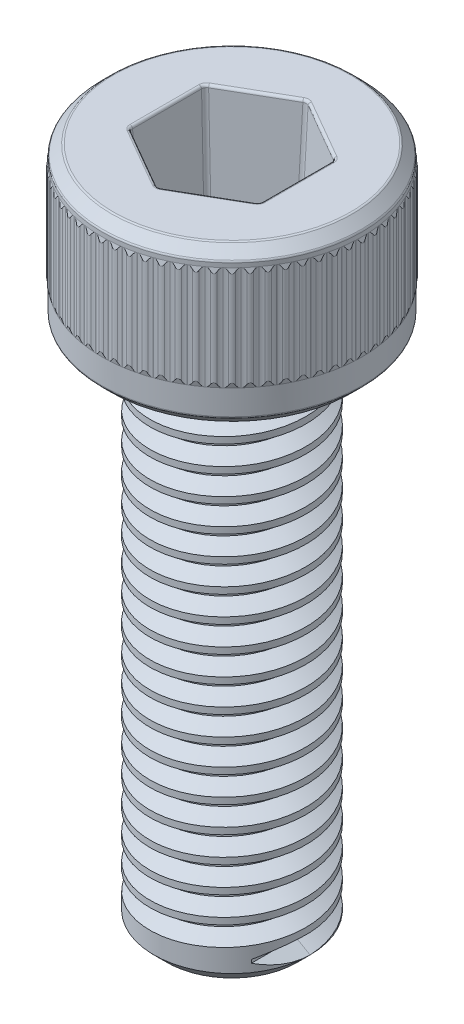
from build123d import *

# Parameters (mm, degrees)
SKETCH_1_R          = 5
EXTRUDE_1_DEPTH     = 6
CUT_EXTRUDE_1_DEPTH = 4
CUT_EXTRUDE_1_DRAFT = -3
FILLET_1_R          = 0.2
FILLET_2_R          = 0.1
CHAMFER_1_SIZE      = 0.4
FILLET_3_R          = 0.1
SKETCH_3_R          = 3
EXTRUDE_2_DEPTH     = 20
CHAMFER_2_SIZE      = 0.5
THREAD_1_PITCH      = 1
EXTRUDE_START       = -0.6
EXTRUDE_3_DEPTH     = 4
CUT_EXTRUDE_2_DEPTH = 22.232335203


with BuildPart() as part:
    # Sketch 1 → Бобышка-Вытянуть1 (new body)
    with BuildSketch(Plane(origin=(0, 0, 0), x_dir=(1, 0, 0), z_dir=(0, 1, 0))):
        with Locations(Location((0, 0, 0), (0, 0, 270))):
            Circle(SKETCH_1_R)
    extrude(amount=EXTRUDE_1_DEPTH)


with BuildPart() as cut_extrude_1_tool:
    # Эскиз2 → Вырез-Вытянуть1 (with draft: the straight prism first)
    with BuildSketch(Plane(origin=(0, 6, 0), x_dir=(1, 0, 0), z_dir=(0, 1, 0))):
        Polygon((0, 2.886751346), (-2.5, 1.443375673), (-2.5, -1.443375673), (0, -2.886751346), (2.5, -1.443375673), (2.5, 1.443375673), align=None)
    extrude(amount=-CUT_EXTRUDE_1_DEPTH)
    # Вырез-Вытянуть1: the draft: its side faces are tilted about the plane it starts from
    cut_extrude_1_sides = [cut_extrude_1_tool.faces().sort_by_distance(p)[0] for p in [
        (-1.25, 4, -2.165063509),
        (-2.5, 4, 0),
        (-1.25, 4, 2.165063509),
        (1.25, 4, 2.165063509),
        (2.5, 4, 0),
        (1.25, 4, -2.165063509),
    ]]
    draft(cut_extrude_1_sides, Plane(origin=(0, 6, 0), x_dir=(1, 0, 0), z_dir=(0, 1, 0)), CUT_EXTRUDE_1_DRAFT)


with BuildPart() as part_1:
    add(part.part)

    # Вырез-Вытянуть1: cut by cut_extrude_1_tool
    add(cut_extrude_1_tool.part, mode=Mode.SUBTRACT)

    # Скругление1
    fillet_1_edges = [part_1.edges().sort_by_distance(p)[0] for p in [
        (-2.395184441, 4, 1.382860382),
        (-2.395184441, 4, -1.382860382),
        (0, 4, -2.765720764),
        (2.395184441, 4, -1.382860382),
        (2.395184441, 4, 1.382860382),
        (0, 4, 2.765720764),
    ]]
    fillet(fillet_1_edges, radius=FILLET_1_R)

    # Скругление2
    fillet_2_edges = [part_1.edges().sort_by_distance(p)[0] for p in [
        (-1.25, 6, 2.165063509),
        (-2.5, 6, 0),
        (1.25, 6, 2.165063509),
        (2.5, 6, 0),
        (1.25, 6, -2.165063509),
        (-1.25, 6, -2.165063509),
        (-2.473247469, 6, 1.427930092),
        (0, 6, 2.855860184),
        (2.473247469, 6, 1.427930092),
        (2.473247469, 6, -1.427930092),
        (0, 6, -2.855860184),
        (-2.473247469, 6, -1.427930092),
    ]]
    fillet(fillet_2_edges, radius=FILLET_2_R)

    # Фаска1
    chamfer_1_edges = [part_1.edges().sort_by_distance(p)[0] for p in [
        (0, 0, -5),
        (0, 6, -5),
    ]]
    chamfer(chamfer_1_edges, length=CHAMFER_1_SIZE)

    # Скругление3
    fillet_3_edges = [part_1.edges().sort_by_distance(p)[0] for p in [
        (0, 6, -4.6),
        (0, 5.6, -5),
        (0, 0.4, -5),
        (0, 0, -4.6),
    ]]
    fillet(fillet_3_edges, radius=FILLET_3_R)

    # Эскиз3 → Бобышка-Вытянуть2 (add)
    with BuildSketch(Plane.XZ):
        with Locations(Location((0, 0, 0), (0, 0, 90))):
            Circle(SKETCH_3_R)
    extrude(amount=EXTRUDE_2_DEPTH)

    # Фаска2
    chamfer_2_edges = [part_1.edges().sort_by_distance(p)[0] for p in [
        (0, -20, -3),
    ]]
    chamfer(chamfer_2_edges, length=CHAMFER_2_SIZE)

    # Резьба1: the profile of Sketch 1 2 profile screwed along a right-hand helix of 19.5 turns, 8 arcs to a turn; built about Z, then put on its axis
    thread_1_z = Axis((0, 0, 0), (0, 0, 1))
    thread_1_corners = [(3.0003, 0, -0.000173205), (2.458734125, 0, 0.312499999), (2.458734125, 0, 0.437499999), (3.0003, 0, 0.750173202)]
    with BuildLine(mode=Mode.PRIVATE) as thread_1_profile:
        Line(thread_1_corners[0], thread_1_corners[1])
        Line(thread_1_corners[1], thread_1_corners[2])
        Line(thread_1_corners[2], thread_1_corners[3])
        Line(thread_1_corners[3], thread_1_corners[0])
    thread_1_cap = Face(thread_1_profile.wire())
    thread_1_turn_angles = [0, 22.5, 45, 67.5, 90, 112.5, 135, 157.5, 180, 202.5, 225, 247.5, 270, 292.5, 315, 337.5, 360]
    thread_1_turn_weights = [1, 0.9238795325112867, 1, 0.9238795325112867, 1, 0.9238795325112867, 1, 0.9238795325112867, 1, 0.9238795325112867, 1, 0.9238795325112867, 1, 0.9238795325112867, 1, 0.9238795325112867, 1]
    thread_1_turn_rails = [Edge.make_bspline([Vector(p[0], p[1], 0).rotate(thread_1_z, thread_1_turn_angles[k]) / thread_1_turn_weights[k] + Vector(0, 0, p[2] + THREAD_1_PITCH * thread_1_turn_angles[k] / 360) for k in range(17)], [0, 0, 0, 1, 1, 2, 2, 3, 3, 4, 4, 5, 5, 6, 6, 7, 7, 8, 8, 8], 2, thread_1_turn_weights) for p in thread_1_corners]
    thread_1_turn_sides = [Face.make_surface_from_curves(thread_1_turn_rails[p[0]], thread_1_turn_rails[p[1]]) for p in [(0, 1), (1, 2), (2, 3), (3, 0)]]
    thread_1_last_angles = [6840, 6862.5, 6885, 6907.5, 6930, 6952.5, 6975, 6997.5, 7020]
    thread_1_last_weights = [1, 0.9238795325112867, 1, 0.9238795325112867, 1, 0.9238795325112867, 1, 0.9238795325112958, 1]
    thread_1_last_rails = [Edge.make_bspline([Vector(p[0], p[1], 0).rotate(thread_1_z, thread_1_last_angles[k]) / thread_1_last_weights[k] + Vector(0, 0, p[2] + THREAD_1_PITCH * thread_1_last_angles[k] / 360) for k in range(9)], [0, 0, 0, 1, 1, 2, 2, 3, 3, 4, 4, 4], 2, thread_1_last_weights) for p in thread_1_corners]
    thread_1_last_sides = [Face.make_surface_from_curves(thread_1_last_rails[p[0]], thread_1_last_rails[p[1]]) for p in [(0, 1), (1, 2), (2, 3), (3, 0)]]
    thread_1 = Plane(origin=(0, -19.5, 0), x_dir=(1, 0, 0), z_dir=(0, 1, 0)) * Solid(Shell([*[p.moved(Location((0, 0, THREAD_1_PITCH * i))) for i in range(19) for p in thread_1_turn_sides], *thread_1_last_sides, thread_1_cap, thread_1_cap.rotate(thread_1_z, 7020).moved(Location((0, 0, THREAD_1_PITCH * 7020 / 360)))]))
    add(thread_1, mode=Mode.SUBTRACT)

    # Эскиз8 → Бобышка-Вытянуть3 (add)
    with BuildSketch(Plane(origin=(0, 6, 0), x_dir=(1, 0, 0), z_dir=(0, 1, 0)).offset(EXTRUDE_START)):
        with BuildLine():
            Line((-0.239429025, 4.994264084), (-0.033196375, 4.753218038))
            Line((-0.033196375, 4.753218038), (0.239429025, 4.994264084))
            ThreePointArc((0.239429025, 4.994264084), (0.164221826, 5.003619827), (0.091292563, 5.024234752))
            ThreePointArc((0.091292563, 5.024234752), (0, 5.040439273), (-0.091292563, 5.024234752))
            ThreePointArc((-0.091292563, 5.024234752), (-0.164221826, 5.003619827), (-0.239429025, 4.994264084))
        make_face()
        with BuildLine():
            Line((0.251247375, 4.993683486), (0.432860314, 4.733583808))
            Line((0.432860314, 4.733583808), (0.727799592, 4.946747189))
            ThreePointArc((0.727799592, 4.946747189), (0.65387156, 4.963429476), (0.583314087, 4.991093453))
            ThreePointArc((0.583314087, 4.991093453), (0.494049444, 5.016168181), (0.401608159, 5.008989924))
            ThreePointArc((0.401608159, 5.008989924), (0.327009454, 4.995622583), (0.251247375, 4.993683486))
        make_face()
        with BuildLine():
            Line((0.739504125, 4.945010986), (0.894748321, 4.668362578))
            Line((0.894748321, 4.668362578), (1.209161052, 4.851590415))
            ThreePointArc((1.209161052, 4.851590415), (1.137224153, 4.875438586), (1.069717977, 4.909885195))
            ThreePointArc((1.069717977, 4.909885195), (0.983340921, 4.943588646), (0.890641174, 4.945505786))
            ThreePointArc((0.890641174, 4.945505786), (0.815091453, 4.939514764), (0.739504125, 4.945010986))
        make_face()
        with BuildLine():
            Line((1.220639047, 4.848715327), (1.348019414, 4.558182464))
            Line((1.348019414, 4.558182464), (1.678877629, 4.709710172))
            ThreePointArc((1.678877629, 4.709710172), (1.609624656, 4.740494557), (1.545819899, 4.781392058))
            ThreePointArc((1.545819899, 4.781392058), (1.463162288, 4.82339965), (1.371096828, 4.834393722))
            ThreePointArc((1.371096828, 4.834393722), (1.295323677, 4.835836717), (1.220639047, 4.848715327))
        make_face()
        with BuildLine():
            Line((1.690018546, 4.705723888), (1.788308342, 4.404104562))
            Line((1.788308342, 4.404104562), (2.132425697, 4.522472846))
            ThreePointArc((2.132425697, 4.522472846), (2.066523594, 4.559896974), (2.00703473, 4.606851503))
            ThreePointArc((2.00703473, 4.606851503), (1.928892602, 4.65675868), (1.83834807, 4.676723805))
            ThreePointArc((1.83834807, 4.676723805), (1.763081226, 4.685586919), (1.690018546, 4.705723888))
        make_face()
        with BuildLine():
            Line((2.143122244, 4.517413757), (2.211374883, 4.207612725))
            Line((2.211374883, 4.207612725), (2.56543734, 4.291681635))
            ThreePointArc((2.56543734, 4.291681635), (2.503520779, 4.335385091), (2.448920719, 4.387944449))
            ThreePointArc((2.448920719, 4.387944449), (2.376046626, 4.445270577), (2.287895015, 4.474014481))
            ThreePointArc((2.287895015, 4.474014481), (2.213859338, 4.490212357), (2.143122244, 4.517413757))
        make_face()
        with BuildLine():
            Line((2.575586503, 4.285598461), (2.613144676, 3.970599277))
            Line((2.613144676, 3.970599277), (2.973742419, 4.019559183))
            ThreePointArc((2.973742419, 4.019559183), (2.916407691, 4.069121079), (2.867222264, 4.126779091))
            ThreePointArc((2.867222264, 4.126779091), (2.800318022, 4.190972088), (2.71540828, 4.228217952))
            ThreePointArc((2.71540828, 4.228217952), (2.643316775, 4.251594596), (2.575586503, 4.285598461))
        make_face()
        with BuildLine():
            Line((2.983246455, 4.012510509), (2.989748456, 3.695346788))
            Line((2.989748456, 3.695346788), (3.353408733, 3.708726179))
            ThreePointArc((3.353408733, 3.708726179), (3.301208003, 3.763669207), (3.25791089, 3.825870595))
            ThreePointArc((3.25791089, 3.825870595), (3.197620824, 3.896312248), (3.11677068, 3.941701372))
            ThreePointArc((3.11677068, 3.941701372), (3.047317626, 3.972031654), (2.983246455, 4.012510509))
        make_face()
        with BuildLine():
            Line((3.362176114, 3.700779888), (3.337559325, 3.384506089))
            Line((3.337559325, 3.384506089), (3.700779888, 3.362176114))
            ThreePointArc((3.700779888, 3.362176114), (3.654215877, 3.421971143), (3.617224053, 3.488116873))
            ThreePointArc((3.617224053, 3.488116873), (3.56412879, 3.56412879), (3.488116873, 3.617224053))
            ThreePointArc((3.488116873, 3.617224053), (3.421971143, 3.654215877), (3.362176114, 3.700779888))
        make_face()
        with BuildLine():
            Line((3.708726179, 3.353408733), (3.653227673, 3.041070747))
            Line((3.653227673, 3.041070747), (4.012510509, 2.983246455))
            ThreePointArc((4.012510509, 2.983246455), (3.972031654, 3.047317626), (3.941701372, 3.11677068))
            ThreePointArc((3.941701372, 3.11677068), (3.896312248, 3.197620824), (3.825870595, 3.25791089))
            ThreePointArc((3.825870595, 3.25791089), (3.763669207, 3.301208003), (3.708726179, 3.353408733))
        make_face()
        with BuildLine():
            Line((4.019559183, 2.973742419), (3.933713441, 2.66834823))
            Line((3.933713441, 2.66834823), (4.285598461, 2.575586503))
            ThreePointArc((4.285598461, 2.575586503), (4.251594596, 2.643316775), (4.228217952, 2.71540828))
            ThreePointArc((4.228217952, 2.71540828), (4.190972088, 2.800318022), (4.126779091, 2.867222264))
            ThreePointArc((4.126779091, 2.867222264), (4.069121079, 2.916407691), (4.019559183, 2.973742419))
        make_face()
        with BuildLine():
            Line((4.291681635, 2.56543734), (4.176315399, 2.269928062))
            Line((4.176315399, 2.269928062), (4.517413757, 2.143122244))
            ThreePointArc((4.517413757, 2.143122244), (4.490212357, 2.213859338), (4.474014481, 2.287895015))
            ThreePointArc((4.474014481, 2.287895015), (4.445270577, 2.376046626), (4.387944449, 2.448920719))
            ThreePointArc((4.387944449, 2.448920719), (4.335385091, 2.503520779), (4.291681635, 2.56543734))
        make_face()
        with BuildLine():
            Line((4.522472846, 2.132425697), (4.378697156, 1.849647245))
            Line((4.378697156, 1.849647245), (4.705723888, 1.690018546))
            ThreePointArc((4.705723888, 1.690018546), (4.685586919, 1.763081226), (4.676723805, 1.83834807))
            ThreePointArc((4.676723805, 1.83834807), (4.65675868, 1.928892602), (4.606851503, 2.00703473))
            ThreePointArc((4.606851503, 2.00703473), (4.559896974, 2.066523594), (4.522472846, 2.132425697))
        make_face()
        with BuildLine():
            Line((4.709710172, 1.678877629), (4.538909666, 1.411553315))
            Line((4.538909666, 1.411553315), (4.848715327, 1.220639047))
            ThreePointArc((4.848715327, 1.220639047), (4.835836717, 1.295323677), (4.834393722, 1.371096828))
            ThreePointArc((4.834393722, 1.371096828), (4.82339965, 1.463162288), (4.781392058, 1.545819899))
            ThreePointArc((4.781392058, 1.545819899), (4.740494557, 1.609624656), (4.709710172, 1.678877629))
        make_face()
        with BuildLine():
            Line((4.851590415, 1.209161052), (4.655409995, 0.959865354))
            Line((4.655409995, 0.959865354), (4.945010986, 0.739504125))
            ThreePointArc((4.945010986, 0.739504125), (4.939514764, 0.815091453), (4.945505786, 0.890641174))
            ThreePointArc((4.945505786, 0.890641174), (4.943588646, 0.983340921), (4.909885195, 1.069717977))
            ThreePointArc((4.909885195, 1.069717977), (4.875438586, 1.137224153), (4.851590415, 1.209161052))
        make_face()
        with BuildLine():
            Line((4.946747189, 0.727799592), (4.72707618, 0.498933365))
            Line((4.72707618, 0.498933365), (4.993683486, 0.251247375))
            ThreePointArc((4.993683486, 0.251247375), (4.995622583, 0.327009454), (5.008989924, 0.401608159))
            ThreePointArc((5.008989924, 0.401608159), (5.016168181, 0.494049444), (4.991093453, 0.583314087))
            ThreePointArc((4.991093453, 0.583314087), (4.963429476, 0.65387156), (4.946747189, 0.727799592))
        make_face()
        with BuildLine():
            Line((4.994264084, 0.239429025), (4.753218038, 0.033196375))
            Line((4.753218038, 0.033196375), (4.994264084, -0.239429025))
            ThreePointArc((4.994264084, -0.239429025), (5.003619827, -0.164221826), (5.024234752, -0.091292563))
            ThreePointArc((5.024234752, -0.091292563), (5.040439273, 0), (5.024234752, 0.091292563))
            ThreePointArc((5.024234752, 0.091292563), (5.003619827, 0.164221826), (4.994264084, 0.239429025))
        make_face()
        with BuildLine():
            Line((4.993683486, -0.251247375), (4.733583808, -0.432860314))
            Line((4.733583808, -0.432860314), (4.946747189, -0.727799592))
            ThreePointArc((4.946747189, -0.727799592), (4.963429476, -0.65387156), (4.991093453, -0.583314087))
            ThreePointArc((4.991093453, -0.583314087), (5.016168181, -0.494049444), (5.008989924, -0.401608159))
            ThreePointArc((5.008989924, -0.401608159), (4.995622583, -0.327009454), (4.993683486, -0.251247375))
        make_face()
        with BuildLine():
            Line((4.945010986, -0.739504125), (4.668362578, -0.894748321))
            Line((4.668362578, -0.894748321), (4.851590415, -1.209161052))
            ThreePointArc((4.851590415, -1.209161052), (4.875438586, -1.137224153), (4.909885195, -1.069717977))
            ThreePointArc((4.909885195, -1.069717977), (4.943588646, -0.983340921), (4.945505786, -0.890641174))
            ThreePointArc((4.945505786, -0.890641174), (4.939514764, -0.815091453), (4.945010986, -0.739504125))
        make_face()
        with BuildLine():
            Line((4.848715327, -1.220639047), (4.558182464, -1.348019414))
            Line((4.558182464, -1.348019414), (4.709710172, -1.678877629))
            ThreePointArc((4.709710172, -1.678877629), (4.740494557, -1.609624656), (4.781392058, -1.545819899))
            ThreePointArc((4.781392058, -1.545819899), (4.82339965, -1.463162288), (4.834393722, -1.371096828))
            ThreePointArc((4.834393722, -1.371096828), (4.835836717, -1.295323677), (4.848715327, -1.220639047))
        make_face()
        with BuildLine():
            Line((4.705723888, -1.690018546), (4.404104562, -1.788308342))
            Line((4.404104562, -1.788308342), (4.522472846, -2.132425697))
            ThreePointArc((4.522472846, -2.132425697), (4.559896974, -2.066523594), (4.606851503, -2.00703473))
            ThreePointArc((4.606851503, -2.00703473), (4.65675868, -1.928892602), (4.676723805, -1.83834807))
            ThreePointArc((4.676723805, -1.83834807), (4.685586919, -1.763081226), (4.705723888, -1.690018546))
        make_face()
        with BuildLine():
            Line((4.517413757, -2.143122244), (4.207612725, -2.211374883))
            Line((4.207612725, -2.211374883), (4.291681635, -2.56543734))
            ThreePointArc((4.291681635, -2.56543734), (4.335385091, -2.503520779), (4.387944449, -2.448920719))
            ThreePointArc((4.387944449, -2.448920719), (4.445270577, -2.376046626), (4.474014481, -2.287895015))
            ThreePointArc((4.474014481, -2.287895015), (4.490212357, -2.213859338), (4.517413757, -2.143122244))
        make_face()
        with BuildLine():
            Line((4.285598461, -2.575586503), (3.970599277, -2.613144676))
            Line((3.970599277, -2.613144676), (4.019559183, -2.973742419))
            ThreePointArc((4.019559183, -2.973742419), (4.069121079, -2.916407691), (4.126779091, -2.867222264))
            ThreePointArc((4.126779091, -2.867222264), (4.190972088, -2.800318022), (4.228217952, -2.71540828))
            ThreePointArc((4.228217952, -2.71540828), (4.251594596, -2.643316775), (4.285598461, -2.575586503))
        make_face()
        with BuildLine():
            Line((4.012510509, -2.983246455), (3.695346788, -2.989748456))
            Line((3.695346788, -2.989748456), (3.708726179, -3.353408733))
            ThreePointArc((3.708726179, -3.353408733), (3.763669207, -3.301208003), (3.825870595, -3.25791089))
            ThreePointArc((3.825870595, -3.25791089), (3.896312248, -3.197620824), (3.941701372, -3.11677068))
            ThreePointArc((3.941701372, -3.11677068), (3.972031654, -3.047317626), (4.012510509, -2.983246455))
        make_face()
        with BuildLine():
            Line((3.700779888, -3.362176114), (3.384506089, -3.337559325))
            Line((3.384506089, -3.337559325), (3.362176114, -3.700779888))
            ThreePointArc((3.362176114, -3.700779888), (3.421971143, -3.654215877), (3.488116873, -3.617224053))
            ThreePointArc((3.488116873, -3.617224053), (3.56412879, -3.56412879), (3.617224053, -3.488116873))
            ThreePointArc((3.617224053, -3.488116873), (3.654215877, -3.421971143), (3.700779888, -3.362176114))
        make_face()
        with BuildLine():
            Line((3.353408733, -3.708726179), (3.041070747, -3.653227673))
            Line((3.041070747, -3.653227673), (2.983246455, -4.012510509))
            ThreePointArc((2.983246455, -4.012510509), (3.047317626, -3.972031654), (3.11677068, -3.941701372))
            ThreePointArc((3.11677068, -3.941701372), (3.197620824, -3.896312248), (3.25791089, -3.825870595))
            ThreePointArc((3.25791089, -3.825870595), (3.301208003, -3.763669207), (3.353408733, -3.708726179))
        make_face()
        with BuildLine():
            Line((2.973742419, -4.019559183), (2.66834823, -3.933713441))
            Line((2.66834823, -3.933713441), (2.575586503, -4.285598461))
            ThreePointArc((2.575586503, -4.285598461), (2.643316775, -4.251594596), (2.71540828, -4.228217952))
            ThreePointArc((2.71540828, -4.228217952), (2.800318022, -4.190972088), (2.867222264, -4.126779091))
            ThreePointArc((2.867222264, -4.126779091), (2.916407691, -4.069121079), (2.973742419, -4.019559183))
        make_face()
        with BuildLine():
            Line((2.56543734, -4.291681635), (2.269928062, -4.176315399))
            Line((2.269928062, -4.176315399), (2.143122244, -4.517413757))
            ThreePointArc((2.143122244, -4.517413757), (2.213859338, -4.490212357), (2.287895015, -4.474014481))
            ThreePointArc((2.287895015, -4.474014481), (2.376046626, -4.445270577), (2.448920719, -4.387944449))
            ThreePointArc((2.448920719, -4.387944449), (2.503520779, -4.335385091), (2.56543734, -4.291681635))
        make_face()
        with BuildLine():
            Line((2.132425697, -4.522472846), (1.849647245, -4.378697156))
            Line((1.849647245, -4.378697156), (1.690018546, -4.705723888))
            ThreePointArc((1.690018546, -4.705723888), (1.763081226, -4.685586919), (1.83834807, -4.676723805))
            ThreePointArc((1.83834807, -4.676723805), (1.928892602, -4.65675868), (2.00703473, -4.606851503))
            ThreePointArc((2.00703473, -4.606851503), (2.066523594, -4.559896974), (2.132425697, -4.522472846))
        make_face()
        with BuildLine():
            Line((1.678877629, -4.709710172), (1.411553315, -4.538909666))
            Line((1.411553315, -4.538909666), (1.220639047, -4.848715327))
            ThreePointArc((1.220639047, -4.848715327), (1.295323677, -4.835836717), (1.371096828, -4.834393722))
            ThreePointArc((1.371096828, -4.834393722), (1.463162288, -4.82339965), (1.545819899, -4.781392058))
            ThreePointArc((1.545819899, -4.781392058), (1.609624656, -4.740494557), (1.678877629, -4.709710172))
        make_face()
        with BuildLine():
            Line((1.209161052, -4.851590415), (0.959865354, -4.655409995))
            Line((0.959865354, -4.655409995), (0.739504125, -4.945010986))
            ThreePointArc((0.739504125, -4.945010986), (0.815091453, -4.939514764), (0.890641174, -4.945505786))
            ThreePointArc((0.890641174, -4.945505786), (0.983340921, -4.943588646), (1.069717977, -4.909885195))
            ThreePointArc((1.069717977, -4.909885195), (1.137224153, -4.875438586), (1.209161052, -4.851590415))
        make_face()
        with BuildLine():
            Line((0.727799592, -4.946747189), (0.498933365, -4.72707618))
            Line((0.498933365, -4.72707618), (0.251247375, -4.993683486))
            ThreePointArc((0.251247375, -4.993683486), (0.327009454, -4.995622583), (0.401608159, -5.008989924))
            ThreePointArc((0.401608159, -5.008989924), (0.494049444, -5.016168181), (0.583314087, -4.991093453))
            ThreePointArc((0.583314087, -4.991093453), (0.65387156, -4.963429476), (0.727799592, -4.946747189))
        make_face()
        with BuildLine():
            Line((0.239429025, -4.994264084), (0.033196375, -4.753218038))
            Line((0.033196375, -4.753218038), (-0.239429025, -4.994264084))
            ThreePointArc((-0.239429025, -4.994264084), (-0.164221826, -5.003619827), (-0.091292563, -5.024234752))
            ThreePointArc((-0.091292563, -5.024234752), (0, -5.040439273), (0.091292563, -5.024234752))
            ThreePointArc((0.091292563, -5.024234752), (0.164221826, -5.003619827), (0.239429025, -4.994264084))
        make_face()
        with BuildLine():
            Line((-0.251247375, -4.993683486), (-0.432860314, -4.733583808))
            Line((-0.432860314, -4.733583808), (-0.727799592, -4.946747189))
            ThreePointArc((-0.727799592, -4.946747189), (-0.65387156, -4.963429476), (-0.583314087, -4.991093453))
            ThreePointArc((-0.583314087, -4.991093453), (-0.494049444, -5.016168181), (-0.401608159, -5.008989924))
            ThreePointArc((-0.401608159, -5.008989924), (-0.327009454, -4.995622583), (-0.251247375, -4.993683486))
        make_face()
        with BuildLine():
            Line((-0.739504125, -4.945010986), (-0.894748321, -4.668362578))
            Line((-0.894748321, -4.668362578), (-1.209161052, -4.851590415))
            ThreePointArc((-1.209161052, -4.851590415), (-1.137224153, -4.875438586), (-1.069717977, -4.909885195))
            ThreePointArc((-1.069717977, -4.909885195), (-0.983340921, -4.943588646), (-0.890641174, -4.945505786))
            ThreePointArc((-0.890641174, -4.945505786), (-0.815091453, -4.939514764), (-0.739504125, -4.945010986))
        make_face()
        with BuildLine():
            Line((-1.220639047, -4.848715327), (-1.348019414, -4.558182464))
            Line((-1.348019414, -4.558182464), (-1.678877629, -4.709710172))
            ThreePointArc((-1.678877629, -4.709710172), (-1.609624656, -4.740494557), (-1.545819899, -4.781392058))
            ThreePointArc((-1.545819899, -4.781392058), (-1.463162288, -4.82339965), (-1.371096828, -4.834393722))
            ThreePointArc((-1.371096828, -4.834393722), (-1.295323677, -4.835836717), (-1.220639047, -4.848715327))
        make_face()
        with BuildLine():
            Line((-1.690018546, -4.705723888), (-1.788308342, -4.404104562))
            Line((-1.788308342, -4.404104562), (-2.132425697, -4.522472846))
            ThreePointArc((-2.132425697, -4.522472846), (-2.066523594, -4.559896974), (-2.00703473, -4.606851503))
            ThreePointArc((-2.00703473, -4.606851503), (-1.928892602, -4.65675868), (-1.83834807, -4.676723805))
            ThreePointArc((-1.83834807, -4.676723805), (-1.763081226, -4.685586919), (-1.690018546, -4.705723888))
        make_face()
        with BuildLine():
            Line((-2.143122244, -4.517413757), (-2.211374883, -4.207612725))
            Line((-2.211374883, -4.207612725), (-2.56543734, -4.291681635))
            ThreePointArc((-2.56543734, -4.291681635), (-2.503520779, -4.335385091), (-2.448920719, -4.387944449))
            ThreePointArc((-2.448920719, -4.387944449), (-2.376046626, -4.445270577), (-2.287895015, -4.474014481))
            ThreePointArc((-2.287895015, -4.474014481), (-2.213859338, -4.490212357), (-2.143122244, -4.517413757))
        make_face()
        with BuildLine():
            Line((-2.575586503, -4.285598461), (-2.613144676, -3.970599277))
            Line((-2.613144676, -3.970599277), (-2.973742419, -4.019559183))
            ThreePointArc((-2.973742419, -4.019559183), (-2.916407691, -4.069121079), (-2.867222264, -4.126779091))
            ThreePointArc((-2.867222264, -4.126779091), (-2.800318022, -4.190972088), (-2.71540828, -4.228217952))
            ThreePointArc((-2.71540828, -4.228217952), (-2.643316775, -4.251594596), (-2.575586503, -4.285598461))
        make_face()
        with BuildLine():
            Line((-2.983246455, -4.012510509), (-2.989748456, -3.695346788))
            Line((-2.989748456, -3.695346788), (-3.353408733, -3.708726179))
            ThreePointArc((-3.353408733, -3.708726179), (-3.301208003, -3.763669207), (-3.25791089, -3.825870595))
            ThreePointArc((-3.25791089, -3.825870595), (-3.197620824, -3.896312248), (-3.11677068, -3.941701372))
            ThreePointArc((-3.11677068, -3.941701372), (-3.047317626, -3.972031654), (-2.983246455, -4.012510509))
        make_face()
        with BuildLine():
            Line((-3.362176114, -3.700779888), (-3.337559325, -3.384506089))
            Line((-3.337559325, -3.384506089), (-3.700779888, -3.362176114))
            ThreePointArc((-3.700779888, -3.362176114), (-3.654215877, -3.421971143), (-3.617224053, -3.488116873))
            ThreePointArc((-3.617224053, -3.488116873), (-3.56412879, -3.56412879), (-3.488116873, -3.617224053))
            ThreePointArc((-3.488116873, -3.617224053), (-3.421971143, -3.654215877), (-3.362176114, -3.700779888))
        make_face()
        with BuildLine():
            Line((-3.708726179, -3.353408733), (-3.653227673, -3.041070747))
            Line((-3.653227673, -3.041070747), (-4.012510509, -2.983246455))
            ThreePointArc((-4.012510509, -2.983246455), (-3.972031654, -3.047317626), (-3.941701372, -3.11677068))
            ThreePointArc((-3.941701372, -3.11677068), (-3.896312248, -3.197620824), (-3.825870595, -3.25791089))
            ThreePointArc((-3.825870595, -3.25791089), (-3.763669207, -3.301208003), (-3.708726179, -3.353408733))
        make_face()
        with BuildLine():
            Line((-4.019559183, -2.973742419), (-3.933713441, -2.66834823))
            Line((-3.933713441, -2.66834823), (-4.285598461, -2.575586503))
            ThreePointArc((-4.285598461, -2.575586503), (-4.251594596, -2.643316775), (-4.228217952, -2.71540828))
            ThreePointArc((-4.228217952, -2.71540828), (-4.190972088, -2.800318022), (-4.126779091, -2.867222264))
            ThreePointArc((-4.126779091, -2.867222264), (-4.069121079, -2.916407691), (-4.019559183, -2.973742419))
        make_face()
        with BuildLine():
            Line((-4.291681635, -2.56543734), (-4.176315399, -2.269928062))
            Line((-4.176315399, -2.269928062), (-4.517413757, -2.143122244))
            ThreePointArc((-4.517413757, -2.143122244), (-4.490212357, -2.213859338), (-4.474014481, -2.287895015))
            ThreePointArc((-4.474014481, -2.287895015), (-4.445270577, -2.376046626), (-4.387944449, -2.448920719))
            ThreePointArc((-4.387944449, -2.448920719), (-4.335385091, -2.503520779), (-4.291681635, -2.56543734))
        make_face()
        with BuildLine():
            Line((-4.522472846, -2.132425697), (-4.378697156, -1.849647245))
            Line((-4.378697156, -1.849647245), (-4.705723888, -1.690018546))
            ThreePointArc((-4.705723888, -1.690018546), (-4.685586919, -1.763081226), (-4.676723805, -1.83834807))
            ThreePointArc((-4.676723805, -1.83834807), (-4.65675868, -1.928892602), (-4.606851503, -2.00703473))
            ThreePointArc((-4.606851503, -2.00703473), (-4.559896974, -2.066523594), (-4.522472846, -2.132425697))
        make_face()
        with BuildLine():
            Line((-4.709710172, -1.678877629), (-4.538909666, -1.411553315))
            Line((-4.538909666, -1.411553315), (-4.848715327, -1.220639047))
            ThreePointArc((-4.848715327, -1.220639047), (-4.835836717, -1.295323677), (-4.834393722, -1.371096828))
            ThreePointArc((-4.834393722, -1.371096828), (-4.82339965, -1.463162288), (-4.781392058, -1.545819899))
            ThreePointArc((-4.781392058, -1.545819899), (-4.740494557, -1.609624656), (-4.709710172, -1.678877629))
        make_face()
        with BuildLine():
            Line((-4.851590415, -1.209161052), (-4.655409995, -0.959865354))
            Line((-4.655409995, -0.959865354), (-4.945010986, -0.739504125))
            ThreePointArc((-4.945010986, -0.739504125), (-4.939514764, -0.815091453), (-4.945505786, -0.890641174))
            ThreePointArc((-4.945505786, -0.890641174), (-4.943588646, -0.983340921), (-4.909885195, -1.069717977))
            ThreePointArc((-4.909885195, -1.069717977), (-4.875438586, -1.137224153), (-4.851590415, -1.209161052))
        make_face()
        with BuildLine():
            Line((-4.946747189, -0.727799592), (-4.72707618, -0.498933365))
            Line((-4.72707618, -0.498933365), (-4.993683486, -0.251247375))
            ThreePointArc((-4.993683486, -0.251247375), (-4.995622583, -0.327009454), (-5.008989924, -0.401608159))
            ThreePointArc((-5.008989924, -0.401608159), (-5.016168181, -0.494049444), (-4.991093453, -0.583314087))
            ThreePointArc((-4.991093453, -0.583314087), (-4.963429476, -0.65387156), (-4.946747189, -0.727799592))
        make_face()
        with BuildLine():
            Line((-4.994264084, -0.239429025), (-4.753218038, -0.033196375))
            Line((-4.753218038, -0.033196375), (-4.994264084, 0.239429025))
            ThreePointArc((-4.994264084, 0.239429025), (-5.003619827, 0.164221826), (-5.024234752, 0.091292563))
            ThreePointArc((-5.024234752, 0.091292563), (-5.040439273, 0), (-5.024234752, -0.091292563))
            ThreePointArc((-5.024234752, -0.091292563), (-5.003619827, -0.164221826), (-4.994264084, -0.239429025))
        make_face()
        with BuildLine():
            Line((-4.993683486, 0.251247375), (-4.733583808, 0.432860314))
            Line((-4.733583808, 0.432860314), (-4.946747189, 0.727799592))
            ThreePointArc((-4.946747189, 0.727799592), (-4.963429476, 0.65387156), (-4.991093453, 0.583314087))
            ThreePointArc((-4.991093453, 0.583314087), (-5.016168181, 0.494049444), (-5.008989924, 0.401608159))
            ThreePointArc((-5.008989924, 0.401608159), (-4.995622583, 0.327009454), (-4.993683486, 0.251247375))
        make_face()
        with BuildLine():
            Line((-4.945010986, 0.739504125), (-4.668362578, 0.894748321))
            Line((-4.668362578, 0.894748321), (-4.851590415, 1.209161052))
            ThreePointArc((-4.851590415, 1.209161052), (-4.875438586, 1.137224153), (-4.909885195, 1.069717977))
            ThreePointArc((-4.909885195, 1.069717977), (-4.943588646, 0.983340921), (-4.945505786, 0.890641174))
            ThreePointArc((-4.945505786, 0.890641174), (-4.939514764, 0.815091453), (-4.945010986, 0.739504125))
        make_face()
        with BuildLine():
            Line((-4.848715327, 1.220639047), (-4.558182464, 1.348019414))
            Line((-4.558182464, 1.348019414), (-4.709710172, 1.678877629))
            ThreePointArc((-4.709710172, 1.678877629), (-4.740494557, 1.609624656), (-4.781392058, 1.545819899))
            ThreePointArc((-4.781392058, 1.545819899), (-4.82339965, 1.463162288), (-4.834393722, 1.371096828))
            ThreePointArc((-4.834393722, 1.371096828), (-4.835836717, 1.295323677), (-4.848715327, 1.220639047))
        make_face()
        with BuildLine():
            Line((-4.705723888, 1.690018546), (-4.404104562, 1.788308342))
            Line((-4.404104562, 1.788308342), (-4.522472846, 2.132425697))
            ThreePointArc((-4.522472846, 2.132425697), (-4.559896974, 2.066523594), (-4.606851503, 2.00703473))
            ThreePointArc((-4.606851503, 2.00703473), (-4.65675868, 1.928892602), (-4.676723805, 1.83834807))
            ThreePointArc((-4.676723805, 1.83834807), (-4.685586919, 1.763081226), (-4.705723888, 1.690018546))
        make_face()
        with BuildLine():
            Line((-4.517413757, 2.143122244), (-4.207612725, 2.211374883))
            Line((-4.207612725, 2.211374883), (-4.291681635, 2.56543734))
            ThreePointArc((-4.291681635, 2.56543734), (-4.335385091, 2.503520779), (-4.387944449, 2.448920719))
            ThreePointArc((-4.387944449, 2.448920719), (-4.445270577, 2.376046626), (-4.474014481, 2.287895015))
            ThreePointArc((-4.474014481, 2.287895015), (-4.490212357, 2.213859338), (-4.517413757, 2.143122244))
        make_face()
        with BuildLine():
            Line((-4.285598461, 2.575586503), (-3.970599277, 2.613144676))
            Line((-3.970599277, 2.613144676), (-4.019559183, 2.973742419))
            ThreePointArc((-4.019559183, 2.973742419), (-4.069121079, 2.916407691), (-4.126779091, 2.867222264))
            ThreePointArc((-4.126779091, 2.867222264), (-4.190972088, 2.800318022), (-4.228217952, 2.71540828))
            ThreePointArc((-4.228217952, 2.71540828), (-4.251594596, 2.643316775), (-4.285598461, 2.575586503))
        make_face()
        with BuildLine():
            Line((-4.012510509, 2.983246455), (-3.695346788, 2.989748456))
            Line((-3.695346788, 2.989748456), (-3.708726179, 3.353408733))
            ThreePointArc((-3.708726179, 3.353408733), (-3.763669207, 3.301208003), (-3.825870595, 3.25791089))
            ThreePointArc((-3.825870595, 3.25791089), (-3.896312248, 3.197620824), (-3.941701372, 3.11677068))
            ThreePointArc((-3.941701372, 3.11677068), (-3.972031654, 3.047317626), (-4.012510509, 2.983246455))
        make_face()
        with BuildLine():
            Line((-3.700779888, 3.362176114), (-3.384506089, 3.337559325))
            Line((-3.384506089, 3.337559325), (-3.362176114, 3.700779888))
            ThreePointArc((-3.362176114, 3.700779888), (-3.421971143, 3.654215877), (-3.488116873, 3.617224053))
            ThreePointArc((-3.488116873, 3.617224053), (-3.56412879, 3.56412879), (-3.617224053, 3.488116873))
            ThreePointArc((-3.617224053, 3.488116873), (-3.654215877, 3.421971143), (-3.700779888, 3.362176114))
        make_face()
        with BuildLine():
            Line((-3.353408733, 3.708726179), (-3.041070747, 3.653227673))
            Line((-3.041070747, 3.653227673), (-2.983246455, 4.012510509))
            ThreePointArc((-2.983246455, 4.012510509), (-3.047317626, 3.972031654), (-3.11677068, 3.941701372))
            ThreePointArc((-3.11677068, 3.941701372), (-3.197620824, 3.896312248), (-3.25791089, 3.825870595))
            ThreePointArc((-3.25791089, 3.825870595), (-3.301208003, 3.763669207), (-3.353408733, 3.708726179))
        make_face()
        with BuildLine():
            Line((-2.973742419, 4.019559183), (-2.66834823, 3.933713441))
            Line((-2.66834823, 3.933713441), (-2.575586503, 4.285598461))
            ThreePointArc((-2.575586503, 4.285598461), (-2.643316775, 4.251594596), (-2.71540828, 4.228217952))
            ThreePointArc((-2.71540828, 4.228217952), (-2.800318022, 4.190972088), (-2.867222264, 4.126779091))
            ThreePointArc((-2.867222264, 4.126779091), (-2.916407691, 4.069121079), (-2.973742419, 4.019559183))
        make_face()
        with BuildLine():
            Line((-2.56543734, 4.291681635), (-2.269928062, 4.176315399))
            Line((-2.269928062, 4.176315399), (-2.143122244, 4.517413757))
            ThreePointArc((-2.143122244, 4.517413757), (-2.213859338, 4.490212357), (-2.287895015, 4.474014481))
            ThreePointArc((-2.287895015, 4.474014481), (-2.376046626, 4.445270577), (-2.448920719, 4.387944449))
            ThreePointArc((-2.448920719, 4.387944449), (-2.503520779, 4.335385091), (-2.56543734, 4.291681635))
        make_face()
        with BuildLine():
            Line((-2.132425697, 4.522472846), (-1.849647245, 4.378697156))
            Line((-1.849647245, 4.378697156), (-1.690018546, 4.705723888))
            ThreePointArc((-1.690018546, 4.705723888), (-1.763081226, 4.685586919), (-1.83834807, 4.676723805))
            ThreePointArc((-1.83834807, 4.676723805), (-1.928892602, 4.65675868), (-2.00703473, 4.606851503))
            ThreePointArc((-2.00703473, 4.606851503), (-2.066523594, 4.559896974), (-2.132425697, 4.522472846))
        make_face()
        with BuildLine():
            Line((-1.678877629, 4.709710172), (-1.411553315, 4.538909666))
            Line((-1.411553315, 4.538909666), (-1.220639047, 4.848715327))
            ThreePointArc((-1.220639047, 4.848715327), (-1.295323677, 4.835836717), (-1.371096828, 4.834393722))
            ThreePointArc((-1.371096828, 4.834393722), (-1.463162288, 4.82339965), (-1.545819899, 4.781392058))
            ThreePointArc((-1.545819899, 4.781392058), (-1.609624656, 4.740494557), (-1.678877629, 4.709710172))
        make_face()
        with BuildLine():
            Line((-1.209161052, 4.851590415), (-0.959865354, 4.655409995))
            Line((-0.959865354, 4.655409995), (-0.739504125, 4.945010986))
            ThreePointArc((-0.739504125, 4.945010986), (-0.815091453, 4.939514764), (-0.890641174, 4.945505786))
            ThreePointArc((-0.890641174, 4.945505786), (-0.983340921, 4.943588646), (-1.069717977, 4.909885195))
            ThreePointArc((-1.069717977, 4.909885195), (-1.137224153, 4.875438586), (-1.209161052, 4.851590415))
        make_face()
        with BuildLine():
            Line((-0.727799592, 4.946747189), (-0.498933365, 4.72707618))
            Line((-0.498933365, 4.72707618), (-0.251247375, 4.993683486))
            ThreePointArc((-0.251247375, 4.993683486), (-0.327009454, 4.995622583), (-0.401608159, 5.008989924))
            ThreePointArc((-0.401608159, 5.008989924), (-0.494049444, 5.016168181), (-0.583314087, 4.991093453))
            ThreePointArc((-0.583314087, 4.991093453), (-0.65387156, 4.963429476), (-0.727799592, 4.946747189))
        make_face()
    extrude(amount=-EXTRUDE_3_DEPTH)

    # Эскиз9 → Вырез-Повернуть1 (revolve, cut)
    with BuildSketch(Plane(origin=(0, 0, 0), x_dir=(0, 0, -1), z_dir=(1, 0, 0))):
        Polygon((5.000005525, 5.4), (5.040439273, 5.211424651), (5.040439273, 5.4), align=None)
        Polygon((5.040439273, 1.4), (5.000005525, 1.4), (5.040439273, 1.588575349), align=None)
    revolve(axis=Axis((0, 0, 0), (0, 1, 0)), mode=Mode.SUBTRACT)

    # Эскиз10 → Вырез-Вытянуть2 (cut, through all)
    with BuildSketch(Plane(origin=(0, 0, 0), x_dir=(-1, 0, 0), z_dir=(0, 0, -1))):
        Polygon((-2.458734125, -19.187500001), (-2.458734125, -19.062500001), (-3, -18.750000003), (-3, -19.5), align=None)
    extrude(amount=-CUT_EXTRUDE_2_DEPTH, mode=Mode.SUBTRACT)


solid = part_1.part
